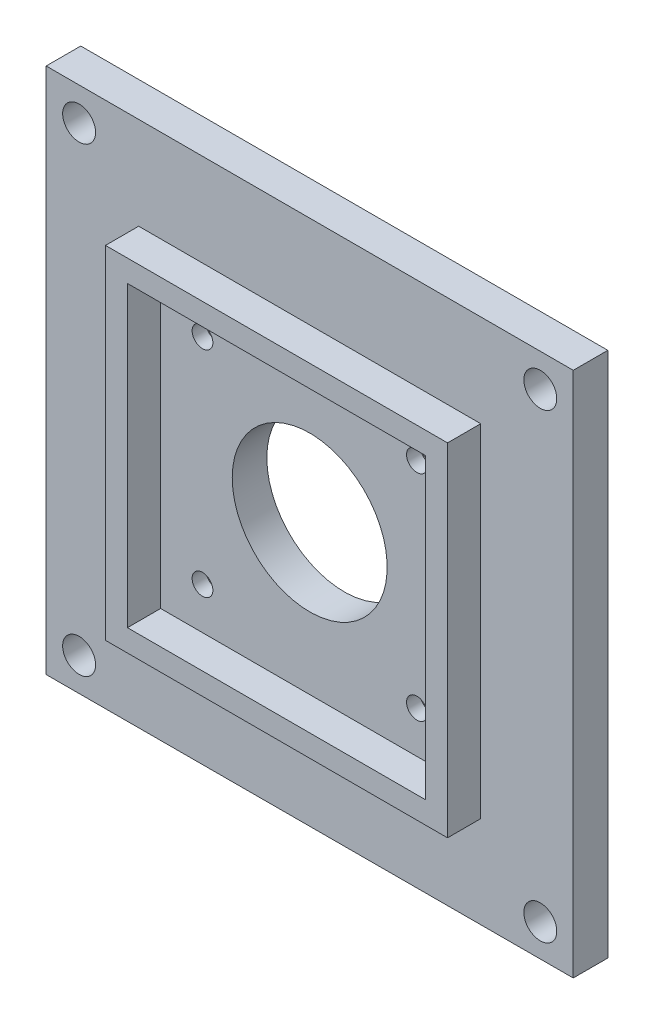
from build123d import *

# Parameters (mm, degrees)
SKETCH5_W      = 49.45
SKETCH5_H      = 49.45
SKETCH5_W_2    = 43.1
SKETCH5_H_2    = 43.1
EXTRUDE1_DEPTH = 4.8
SKETCH6_R      = 1.5
SKETCH6_R_2    = 2.38125
SKETCH6_R_3    = 11.2
EXTRUDE2_DEPTH = 5
SKETCH7_R      = 6
EXTRUDE3_DEPTH = 3


with BuildPart() as part:
    # Sketch5 → Extrude1 (new body)
    with BuildSketch(Plane.XY):
        with Locations((-46.55, 0)):
            Rectangle(SKETCH5_W, SKETCH5_H)
        with Locations((-46.55, 0)):
            Rectangle(SKETCH5_W_2, SKETCH5_H_2, mode=Mode.SUBTRACT)
    extrude(amount=EXTRUDE1_DEPTH)

    # Sketch6 → Extrude2 (add)
    with BuildSketch(Plane(origin=(0, 0, 0), x_dir=(-1, 0, 0), z_dir=(0, 0, -1))):
        Polygon((8.45, 38.1), (8.45, -37.987007671), (84.65, -38.1), (84.65, 38.1), align=None)
        with Locations((62.05, 15.5)):
            Circle(SKETCH6_R, mode=Mode.SUBTRACT)
        with Locations((31.05, 15.5)):
            Circle(SKETCH6_R, mode=Mode.SUBTRACT)
        with Locations((62.05, -15.5)):
            Circle(SKETCH6_R, mode=Mode.SUBTRACT)
        with Locations((31.05, -15.5)):
            Circle(SKETCH6_R, mode=Mode.SUBTRACT)
        with Locations((13.2125, 33.3375)):
            Circle(SKETCH6_R_2, mode=Mode.SUBTRACT)
        with Locations((79.8875, 33.3375)):
            Circle(SKETCH6_R_2, mode=Mode.SUBTRACT)
        with Locations((79.8875, -33.309394929)):
            Circle(SKETCH6_R_2, mode=Mode.SUBTRACT)
        with Locations((13.2125, -33.3375)):
            Circle(SKETCH6_R_2, mode=Mode.SUBTRACT)
        with Locations((46.55, 0)):
            Circle(SKETCH6_R_3, mode=Mode.SUBTRACT)
    extrude(amount=EXTRUDE2_DEPTH)

    # Sketch7 → Extrude3 (cut)
    with BuildSketch(Plane(origin=(0, 0, -5), x_dir=(-1, 0, 0), z_dir=(0, 0, -1))):
        with Locations((31.05, 15.5)):
            Circle(SKETCH7_R)
        with Locations((62.05, 15.5)):
            Circle(SKETCH7_R)
        with Locations((62.05, -15.5)):
            Circle(SKETCH7_R)
        with Locations((31.05, -15.5)):
            Circle(SKETCH7_R)
    extrude(amount=-EXTRUDE3_DEPTH, mode=Mode.SUBTRACT)


solid = part.part
